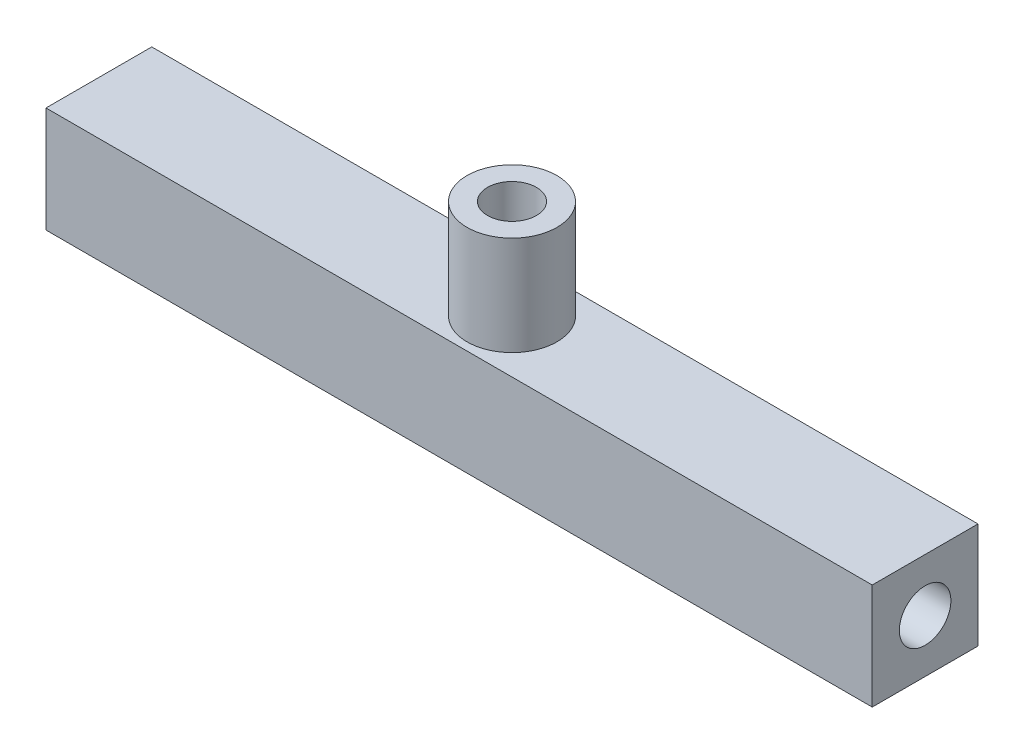
from build123d import *

# Parameters (mm, degrees)
SKETCH1_W           = 10.16
SKETCH1_H           = 10.16
BOSS_EXTRUDE1_DEPTH = 79.375
SKETCH8_R           = 4.318
BOSS_EXTRUDE3_DEPTH = 9.525
SKETCH9_R           = 2.3495
CUT_EXTRUDE5_DEPTH  = 6.35
SKETCH10_R          = 2.4765
CUT_EXTRUDE6_DEPTH  = 79.375


with BuildPart() as part:
    # Sketch1 → Boss-Extrude1 (new body)
    with BuildSketch(Plane(origin=(0, 0, 0), x_dir=(0, 0, -1), z_dir=(1, 0, 0))):
        with Locations((5.08, 5.08)):
            Rectangle(SKETCH1_W, SKETCH1_H)
    extrude(amount=BOSS_EXTRUDE1_DEPTH)

    # Sketch8 → Boss-Extrude3 (add)
    with BuildSketch(Plane(origin=(0, 10.16, 0), x_dir=(1, 0, 0), z_dir=(0, 1, 0))):
        with Locations((39.6875, 5.08)):
            Circle(SKETCH8_R)
    extrude(amount=BOSS_EXTRUDE3_DEPTH)

    # Sketch9 → Cut-Extrude5 (cut)
    with BuildSketch(Plane(origin=(0, 19.685, 0), x_dir=(1, 0, 0), z_dir=(0, 1, 0))):
        with Locations((39.6875, 5.08)):
            Circle(SKETCH9_R)
    extrude(amount=-CUT_EXTRUDE5_DEPTH, mode=Mode.SUBTRACT)

    # Sketch10 → Cut-Extrude6 (cut)
    with BuildSketch(Plane(origin=(79.375, 0, 0), x_dir=(0, 0, -1), z_dir=(1, 0, 0))):
        with Locations((5.08, 5.08)):
            Circle(SKETCH10_R)
    extrude(amount=-CUT_EXTRUDE6_DEPTH, mode=Mode.SUBTRACT)


solid = part.part
